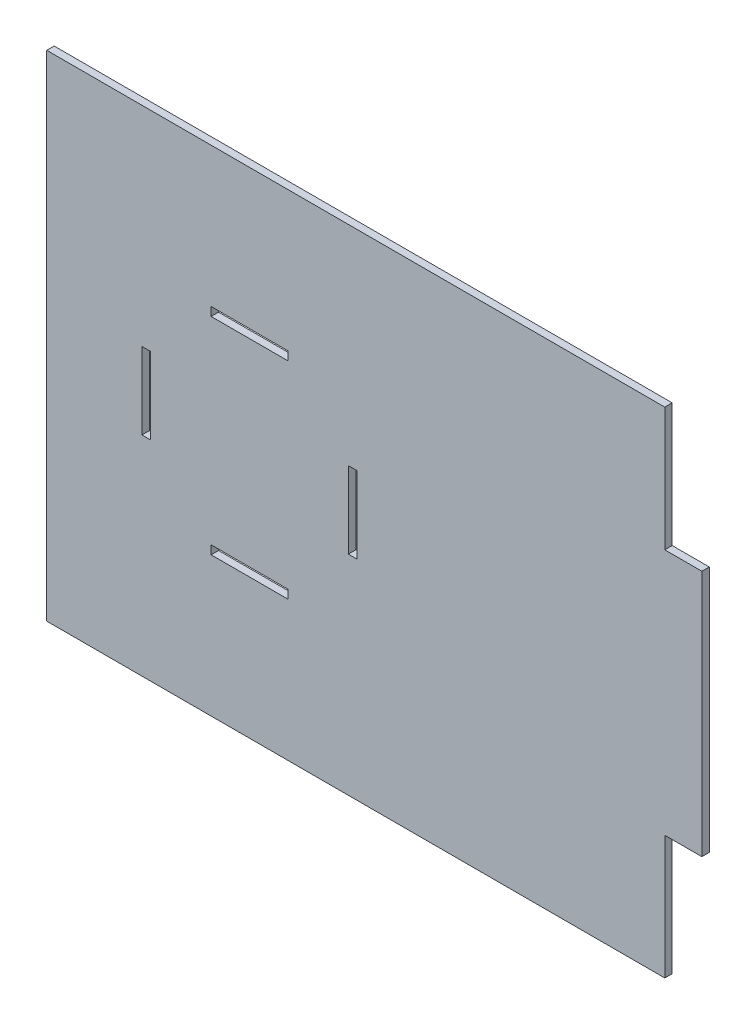
from build123d import *

# Parameters (mm, degrees)
ESBO_O1_W                = 500
ESBO_O1_H                = 200
RESSALTO_EXTRUS_O1_DEPTH = 3
ESBO_O2_W                = 3.5
ESBO_O2_H                = 31
ESBO_O2_W_2              = 31
ESBO_O2_H_2              = 3.5
CORTE_EXTRUS_O1_DEPTH    = 270.274952419
CORTE_EXTRUS_O2_DEPTH    = 270.274952419


with BuildPart() as part:
    # Esboço1 → Ressalto-extrusão1 (new body)
    with BuildSketch(Plane.XY):
        Rectangle(ESBO_O1_W, ESBO_O1_H)
    extrude(amount=RESSALTO_EXTRUS_O1_DEPTH)

    # Esboço2 → Corte-extrusão1 (cut, through all)
    with BuildSketch(Plane.XY.offset(3)):
        with Locations((209.75, 0)):
            Rectangle(ESBO_O2_W, ESBO_O2_H)
        with Locations((-126.25, 0)):
            Rectangle(ESBO_O2_W, ESBO_O2_H)
        with Locations((-209.75, 0)):
            Rectangle(ESBO_O2_W, ESBO_O2_H)
        with Locations((-168, 41.75)):
            Rectangle(ESBO_O2_W_2, ESBO_O2_H_2)
        with Locations((-168, -41.75)):
            Rectangle(ESBO_O2_W_2, ESBO_O2_H_2)
        with Locations((126.25, 0)):
            Rectangle(ESBO_O2_W, ESBO_O2_H)
        with Locations((168, -41.75)):
            Rectangle(ESBO_O2_W_2, ESBO_O2_H_2)
        with Locations((168, 41.75)):
            Rectangle(ESBO_O2_W_2, ESBO_O2_H_2)
    extrude(amount=-CORTE_EXTRUS_O1_DEPTH, mode=Mode.SUBTRACT)

    # Esboço3 → Corte-extrusão2 (cut, through all)
    with BuildSketch(Plane.XY.offset(3)):
        Polygon((0, 100), (0, 50), (15, 50), (15, -50), (0, -50), (0, -100), (250, -100), (250, 100), align=None)
    extrude(amount=-CORTE_EXTRUS_O2_DEPTH, mode=Mode.SUBTRACT)


solid = part.part
